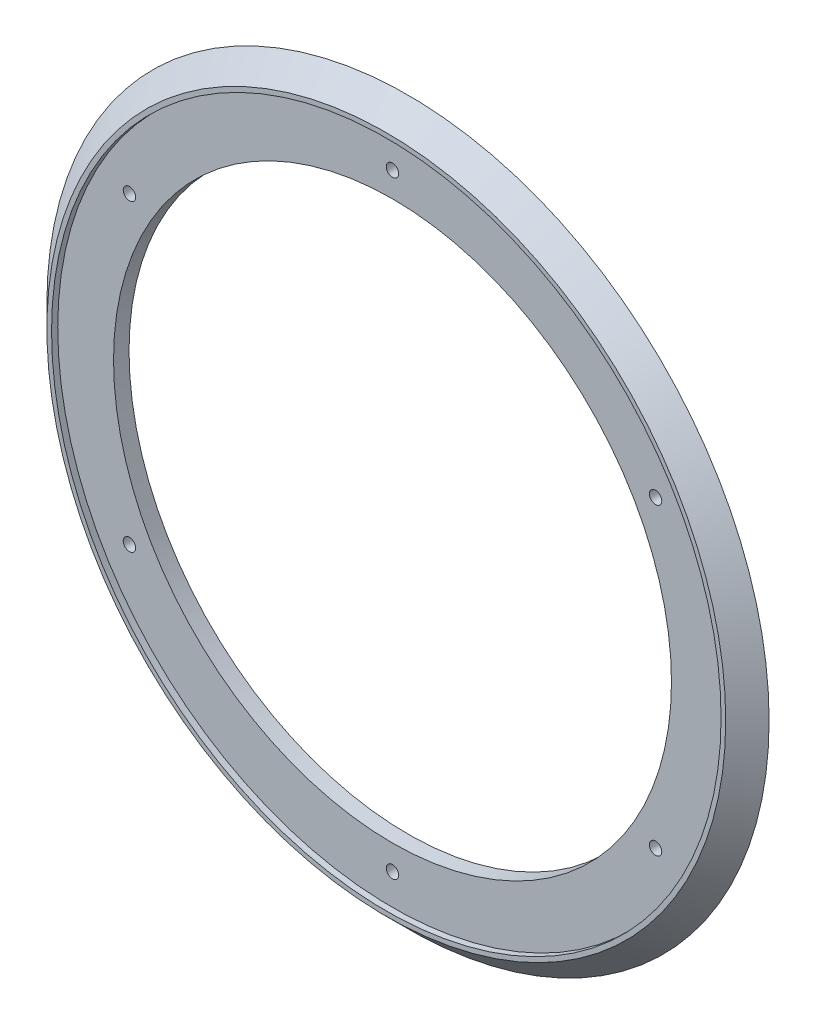
from build123d import *

# Parameters (mm, degrees)
SKETCH1_R           = 119.5
BOSS_EXTRUDE1_DEPTH = 7
CHAMFER2_SIZE       = 10
SKETCH3_R           = 108
CUT_EXTRUDE1_DEPTH  = 2
SKETCH4_R           = 90
SKETCH4_R_2         = 2
CUT_EXTRUDE2_DEPTH  = 165.904517828


with BuildPart() as part:
    # Sketch1 → Boss-Extrude1 (new body)
    with BuildSketch(Plane.XY):
        Circle(SKETCH1_R)
    extrude(amount=BOSS_EXTRUDE1_DEPTH)

    # Chamfer2
    # the kernel refuses this chamfer: 10 mm, written as the material it takes off along each edge
    with BuildSketch(Plane(origin=(0, 0, 7), x_dir=(1, 0, 0), z_dir=(0, -1, 0))) as chamfer2_piece_1:
        Polygon((119.5, -CHAMFER2_SIZE), (119.5 - CHAMFER2_SIZE, 0), (119.5, 0), align=None)
    revolve(axis=Axis((0, 0, 7), (0, 0, 1)), mode=Mode.SUBTRACT)

    # Sketch3 → Cut-Extrude1 (cut)
    with BuildSketch(Plane.XY.offset(7)):
        Circle(SKETCH3_R)
    extrude(amount=-CUT_EXTRUDE1_DEPTH, mode=Mode.SUBTRACT)

    # Sketch4 → Cut-Extrude2 (cut, through all)
    with BuildSketch(Plane(origin=(0, 0, 0), x_dir=(-1, 0, 0), z_dir=(0, 0, -1))):
        Circle(SKETCH4_R)
        with Locations((0, 98)):
            Circle(SKETCH4_R_2)
        with Locations((84.870489571, 49)):
            Circle(SKETCH4_R_2)
        with Locations((84.870489571, -49)):
            Circle(SKETCH4_R_2)
        with Locations((0, -98)):
            Circle(SKETCH4_R_2)
        with Locations((-84.870489571, -49)):
            Circle(SKETCH4_R_2)
        with Locations((-84.870489571, 49)):
            Circle(SKETCH4_R_2)
    extrude(amount=-CUT_EXTRUDE2_DEPTH, mode=Mode.SUBTRACT)


solid = part.part
